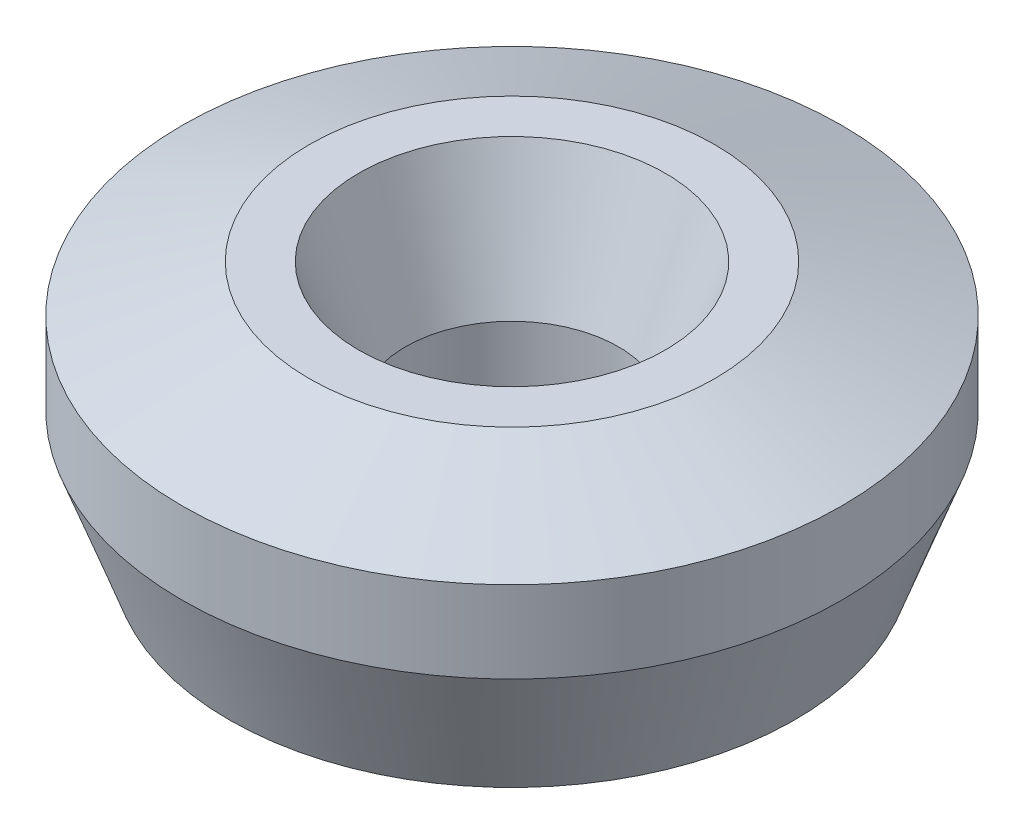
from build123d import *
from OCP.BRepFilletAPI import BRepFilletAPI_MakeChamfer

# Parameters (mm, degrees)
SKETCH1_R           = 10
BOSS_EXTRUDE1_DEPTH = 7.745418689
SKETCH2_R           = 3.230286581
CUT_EXTRUDE1_DEPTH  = 17.124252251
CHAMFER1_SIZE       = 1.418370276
CHAMFER1_SIZE2      = 3.850190915


with BuildPart() as part:
    # Sketch1 → Boss-Extrude1 (new body)
    with BuildSketch(Plane(origin=(0, 0, 0), x_dir=(1, 0, 0), z_dir=(0, 1, 0))):
        Circle(SKETCH1_R)
    extrude(amount=BOSS_EXTRUDE1_DEPTH)

    # Sketch2 → Cut-Extrude1 (cut, through all)
    with BuildSketch(Plane(origin=(0, 0, 0), x_dir=(1, 0, 0), z_dir=(0, 1, 0))):
        Circle(SKETCH2_R)
    extrude(amount=CUT_EXTRUDE1_DEPTH, mode=Mode.SUBTRACT)

    # Chamfer1: one chamfer whose edges measure the first distance from different faces: ONE call of the kernel's chamfer builder (chamfer() names one face for all edges)
    chamfer1_edges_1 = [part.edges().sort_by_distance(p)[0] for p in [
        (-3.230286581, 7.745418689, 0),
    ]]
    chamfer1_side_1 = [part.faces().sort_by_distance(p)[0] for p in [
        (-9.717157288, 7.745418689, 0),
    ]]
    chamfer1_edges_2 = [part.edges().sort_by_distance(p)[0] for p in [
        (-3.230286581, 0, 0),
    ]]
    chamfer1_side_2 = [part.faces().sort_by_distance(p)[0] for p in [
        (-3.230286581, 3.872709344, 0),
    ]]
    chamfer1_edges_3 = [part.edges().sort_by_distance(p)[0] for p in [
        (-10, 0, 0),
    ]]
    chamfer1_side_3 = [part.faces().sort_by_distance(p)[0] for p in [
        (-9.717157288, 0, 0),
    ]]
    chamfer1_edges_4 = [part.edges().sort_by_distance(p)[0] for p in [
        (-10, 7.745418689, 0),
    ]]
    chamfer1_side_4 = [part.faces().sort_by_distance(p)[0] for p in [
        (-10, 3.872709344, 0),
    ]]
    chamfer1 = BRepFilletAPI_MakeChamfer(part.part.solid().wrapped)
    for e in chamfer1_edges_1:
        chamfer1.Add(CHAMFER1_SIZE, CHAMFER1_SIZE2, e.wrapped, chamfer1_side_1[0].wrapped)  # the first distance lies on this face
    for e in chamfer1_edges_2:
        chamfer1.Add(CHAMFER1_SIZE, CHAMFER1_SIZE2, e.wrapped, chamfer1_side_2[0].wrapped)  # the first distance lies on this face
    for e in chamfer1_edges_3:
        chamfer1.Add(CHAMFER1_SIZE, CHAMFER1_SIZE2, e.wrapped, chamfer1_side_3[0].wrapped)  # the first distance lies on this face
    for e in chamfer1_edges_4:
        chamfer1.Add(CHAMFER1_SIZE, CHAMFER1_SIZE2, e.wrapped, chamfer1_side_4[0].wrapped)  # the first distance lies on this face
    add(Compound.cast(chamfer1.Shape()), mode=Mode.REPLACE)


solid = part.part
